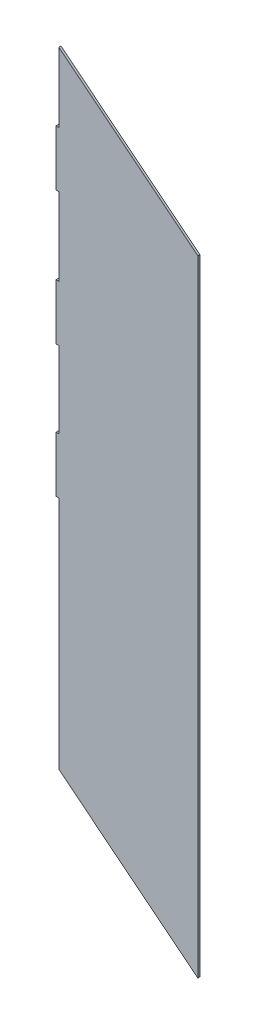
from build123d import *

# Parameters (mm, degrees)
BOSS_EXTRUDE1_DEPTH = 1.5
SKETCH7_W           = 1.5
SKETCH7_H           = 40
BOSS_EXTRUDE3_DEPTH = 2


with BuildPart() as part:
    # Sketch1 → Boss-Extrude1 (new body)
    with BuildSketch(Plane.XY):
        Polygon((0, -152.136839442), (0, 297.863160558), (100, 217.863160558), (100, -232.136839442), align=None)
    extrude(amount=BOSS_EXTRUDE1_DEPTH)

    # Sketch7 → Boss-Extrude3 (add)
    with BuildSketch(Plane.ZY):
        with Locations((0.75, 227.863160558)):
            Rectangle(SKETCH7_W, SKETCH7_H)
        with Locations((0.75, 131.983352075)):
            Rectangle(SKETCH7_W, SKETCH7_H)
        with Locations((0.75, 36.983352075)):
            Rectangle(SKETCH7_W, SKETCH7_H)
    extrude(amount=BOSS_EXTRUDE3_DEPTH)


solid = part.part
